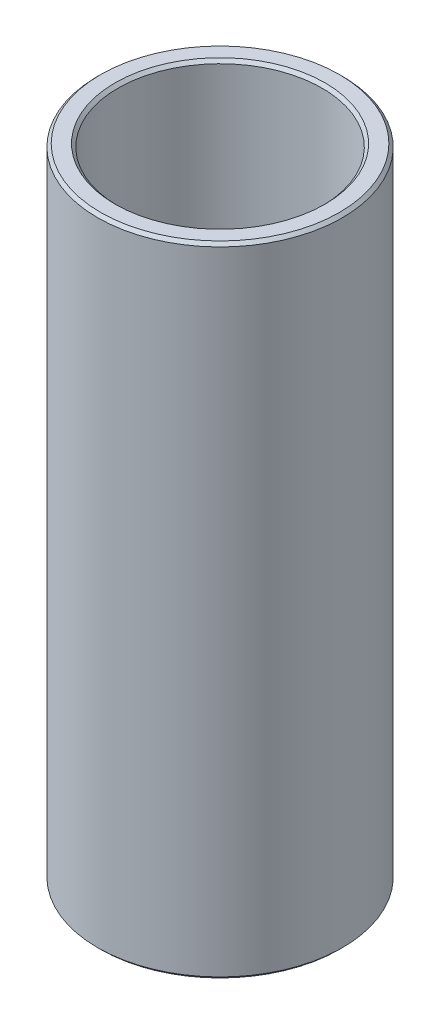
from build123d import *

# Parameters (mm, degrees)
SKETCH1_R           = 40
BOSS_EXTRUDE1_DEPTH = 208.504632293
SKETCH2_R           = 33.331435265
CUT_EXTRUDE1_DEPTH  = 217.04208314
CHAMFER1_SIZE       = 0.992620525


with BuildPart() as part:
    # Sketch1 → Boss-Extrude1 (new body)
    with BuildSketch(Plane(origin=(0, 0, 0), x_dir=(1, 0, 0), z_dir=(0, 1, 0))):
        Circle(SKETCH1_R)
    extrude(amount=BOSS_EXTRUDE1_DEPTH)

    # Sketch2 → Cut-Extrude1 (cut, through all)
    with BuildSketch(Plane(origin=(0, 0, 0), x_dir=(1, 0, 0), z_dir=(0, 1, 0))):
        Circle(SKETCH2_R)
    extrude(amount=CUT_EXTRUDE1_DEPTH, mode=Mode.SUBTRACT)

    # Chamfer1
    chamfer1_edges = [part.edges().sort_by_distance(p)[0] for p in [
        (-33.331435265, 208.504632293, 0),
        (-33.331435265, 0, 0),
        (-40, 0, 0),
        (-40, 208.504632293, 0),
    ]]
    chamfer(chamfer1_edges, length=CHAMFER1_SIZE)


solid = part.part
